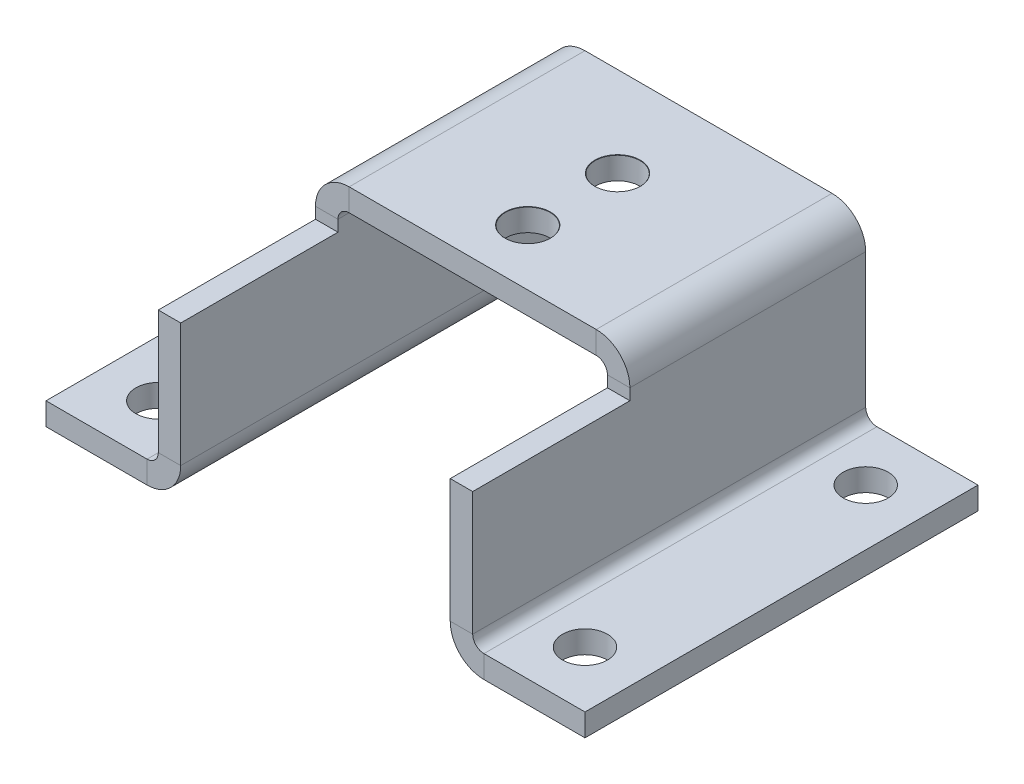
from build123d import *

# Parameters (mm, degrees)
BASE_FLANGE1_DEPTH                 = 35
SKETCH6_W                          = 28
SKETCH6_H                          = 14
CUT_EXTRUDE1_DEPTH                 = 4
F_4_0_4_DIAMETER_HOLE1_D           = 4
F_4_0_4_DIAMETER_HOLE1_CSINK_D     = 4.05
F_4_0_4_DIAMETER_HOLE1_CSINK_ANGLE = 90


# Sheet-metal steps are written as plain solids
with BuildPart() as part:
    # Sketch1 → Base-Flange1 (new body)
    with BuildSketch(Plane.XY):
        with BuildLine():
            Line((0, 0), (-9, 0))
            ThreePointArc((-9, 0), (-11.121320344, 0.878679656), (-12, 3))
            Line((-12, 3), (-12, 15))
            ThreePointArc((-12, 15), (-12.292893219, 15.707106781), (-13, 16))
            Line((-13, 16), (-35, 16))
            ThreePointArc((-35, 16), (-35.707106781, 15.707106781), (-36, 15))
            Line((-36, 15), (-36, 3))
            ThreePointArc((-36, 3), (-36.878679656, 0.878679656), (-39, 0))
            Line((-39, 0), (-48, 0))
            Line((-48, 0), (-48, 2))
            Line((-48, 2), (-39, 2))
            ThreePointArc((-39, 2), (-38.292893219, 2.292893219), (-38, 3))
            Line((-38, 3), (-38, 15))
            ThreePointArc((-38, 15), (-37.121320344, 17.121320344), (-35, 18))
            Line((-35, 18), (-13, 18))
            ThreePointArc((-13, 18), (-10.878679656, 17.121320344), (-10, 15))
            Line((-10, 15), (-10, 3))
            ThreePointArc((-10, 3), (-9.707106781, 2.292893219), (-9, 2))
            Line((-9, 2), (0, 2))
            Line((0, 2), (0, 0))
        make_face()
    extrude(amount=-BASE_FLANGE1_DEPTH)

    # Sketch6 → Cut-Extrude1 (cut)
    with BuildSketch(Plane(origin=(0, 18, 0), x_dir=(1, 0, 0), z_dir=(0, 1, 0))):
        with Locations((-24, 7)):
            Rectangle(SKETCH6_W, SKETCH6_H)
    extrude(amount=-CUT_EXTRUDE1_DEPTH, mode=Mode.SUBTRACT)

    # Ø4.0 (4) Diameter Hole1 (through all)
    with Locations(Plane(origin=(0, 18, 0), x_dir=(1, 0, 0), z_dir=(0, 1, 0))):
        with Locations((-24.099356194, 27), (-24.099356194, 19), (-43, 30), (-43, 5), (-5, 5), (-5, 30)):
            CounterSinkHole(F_4_0_4_DIAMETER_HOLE1_D / 2, F_4_0_4_DIAMETER_HOLE1_CSINK_D / 2, counter_sink_angle=F_4_0_4_DIAMETER_HOLE1_CSINK_ANGLE)


solid = part.part
